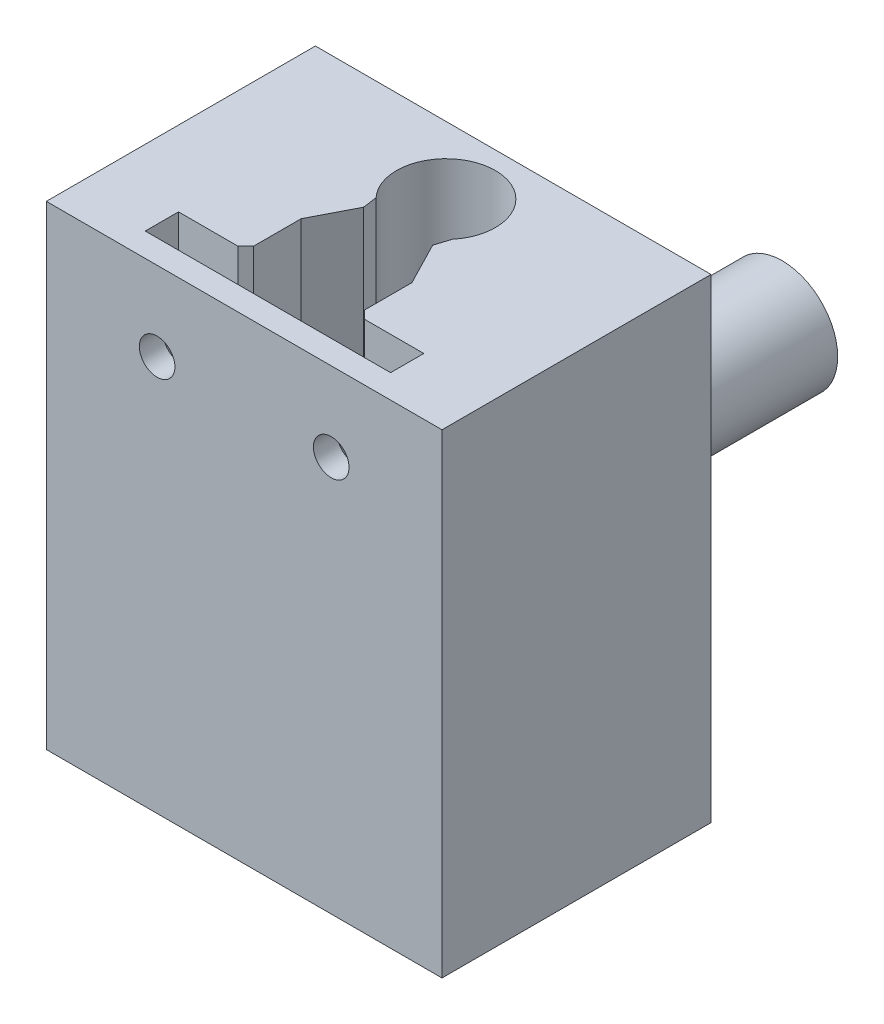
from build123d import *

# Parameters (mm, degrees)
SKETCH1_W           = 50
SKETCH1_H           = 34
BOSS_EXTRUDE1_DEPTH = 60
CUT_EXTRUDE1_DEPTH  = 68.186308129
SKETCH3_R           = 2.25
CUT_EXTRUDE2_DEPTH  = 74.35529974
CUT_EXTRUDE3_DEPTH  = 24.8
CHAMFER1_SIZE       = 1
CHAMFER1_SIZE_2     = 1.220120443
SKETCH5_R           = 7
BOSS_EXTRUDE2_DEPTH = 14
SKETCH6_R           = 7
SKETCH6_R_2         = 4.15
BOSS_EXTRUDE3_DEPTH = 20
CHAMFER2_SIZE       = 10
CHAMFER2_SIZE2      = 0.174550649
CHAMFER4_SIZE       = 10


with BuildPart() as part:
    # Sketch1 → Boss-Extrude1 (new body)
    with BuildSketch(Plane(origin=(0, 0, 0), x_dir=(1, 0, 0), z_dir=(0, 1, 0))):
        Rectangle(SKETCH1_W, SKETCH1_H)
    extrude(amount=BOSS_EXTRUDE1_DEPTH)

    # Sketch2 → Cut-Extrude1 (cut, through all)
    with BuildSketch(Plane(origin=(0, 60, 0), x_dir=(1, 0, 0), z_dir=(0, 1, 0))):
        with BuildLine():
            Line((-3.75, 3.5), (-7, -2.8))
            Line((-7, -2.8), (-7, -9.8))
            Line((-7, -9.8), (-15.5, -9.8))
            Line((-15.5, -9.8), (-15.5, -14))
            Line((-15.5, -14), (15.5, -14))
            Line((15.5, -14), (15.5, -9.8))
            Line((15.5, -9.8), (7, -9.8))
            Line((7, -9.8), (7, -2.8))
            Line((7, -2.8), (3.75, 3.5))
            ThreePointArc((3.75, 3.5), (0, 14.75), (-3.75, 3.5))
        make_face()
    extrude(amount=-CUT_EXTRUDE1_DEPTH, mode=Mode.SUBTRACT)

    # Sketch3 → Cut-Extrude2 (cut, through all)
    with BuildSketch(Plane.XY.offset(17)):
        with Locations((-11, 50)):
            Circle(SKETCH3_R)
        with Locations((11, 50)):
            Circle(SKETCH3_R)
    extrude(amount=-CUT_EXTRUDE2_DEPTH, mode=Mode.SUBTRACT)

    # Sketch4 → Cut-Extrude3 (cut)
    with BuildSketch(Plane(origin=(0, 0, -17), x_dir=(-1, 0, 0), z_dir=(0, 0, -1))):
        Polygon((14.75, 52.165063509), (11, 54.330127019), (7.25, 52.165063509), (7.25, 47.834936491), (11, 45.669872981), (14.75, 47.834936491), align=None)
        Polygon((-7.25, 47.834936491), (-7.25, 52.165063509), (-11, 54.330127019), (-14.75, 52.165063509), (-14.75, 47.834936491), (-11, 45.669872981), align=None)
    extrude(amount=-CUT_EXTRUDE3_DEPTH, mode=Mode.SUBTRACT)

    # Chamfer1
    # the kernel refuses this chamfer: 1.220120443, 1 mm, written as the material it takes off along each edge
    with BuildSketch(Plane(origin=(-7, 62.571682988, 9.8), x_dir=(-1, 0, 0), z_dir=(0, -1, 0)), Plane(origin=(7, 62.571682988, 9.8), x_dir=(0, 0, -1), z_dir=(0, -1, 0))) as chamfer1_piece_1:
        Polygon((CHAMFER1_SIZE, 0), (0, CHAMFER1_SIZE), (0, 0), align=None)
    extrude(amount=65.143365976, mode=Mode.SUBTRACT)
    with BuildSketch(Plane(origin=(-3.75, 63.150527813, -3.5), x_dir=(-0.45846324589157744, 0, 0.8887133689590581), z_dir=(0, -1, 0))) as chamfer1_piece_2:
        with BuildLine():
            Line((CHAMFER1_SIZE_2, 0), (-0.278286757, 1.065574765))
            ThreePointArc((-0.278286757, 1.065574765), (-0.120412167, 0.557139368), (0, 0))
            Line((0, 0), (CHAMFER1_SIZE_2, 0))
        make_face()
    extrude(amount=66.301055626, mode=Mode.SUBTRACT)
    with BuildSketch(Plane(origin=(3.75, 63.795705698, -3.5), x_dir=(0.7235959376340886, 0, -0.6902238180760238), z_dir=(0, -1, 0))) as chamfer1_piece_3:
        with BuildLine():
            Line((1.475268649, 0), (-CHAMFER1_SIZE * 0.281668992416, CHAMFER1_SIZE * 0.959511635527))
            Line((-CHAMFER1_SIZE * 0.281668992416, CHAMFER1_SIZE * 0.959511635527), (0, 0))
            ThreePointArc((0, 0), (0.759242358, 0.043643641), (1.475268649, 0))
        make_face()
    extrude(amount=67.591411396, mode=Mode.SUBTRACT)

    # Sketch5 → Boss-Extrude2 (add)
    with BuildSketch(Plane(origin=(0, 0, -17), x_dir=(-1, 0, 0), z_dir=(0, 0, -1))):
        with Locations(Location((0, 25, 0), (0, 0, 180))):
            Circle(SKETCH5_R)
    extrude(amount=BOSS_EXTRUDE2_DEPTH)

    # Sketch6 → Boss-Extrude3 (add)
    with BuildSketch(Plane(origin=(0, 0, -31), x_dir=(-1, 0, 0), z_dir=(0, 0, -1))):
        with Locations(Location((0, 25, 0), (0, 0, 180))):
            Circle(SKETCH6_R)
        with Locations((0, 25)):
            Circle(SKETCH6_R_2, mode=Mode.SUBTRACT)
    extrude(amount=BOSS_EXTRUDE3_DEPTH)

    # Chamfer2
    chamfer2_edges = [part.edges().sort_by_distance(p)[0] for p in [
        (4.15, 25, -31),
    ]]
    chamfer2_side = [part.faces().sort_by_distance(p)[0] for p in [
        (4.15, 25, -41),
    ]]
    chamfer(chamfer2_edges, length=CHAMFER2_SIZE, length2=CHAMFER2_SIZE2, reference=chamfer2_side[0])

    # Chamfer4
    chamfer4_edges = [part.edges().sort_by_distance(p)[0] for p in [
        (-7, 25, -17),
    ]]
    chamfer(chamfer4_edges, length=CHAMFER4_SIZE)


solid = part.part
